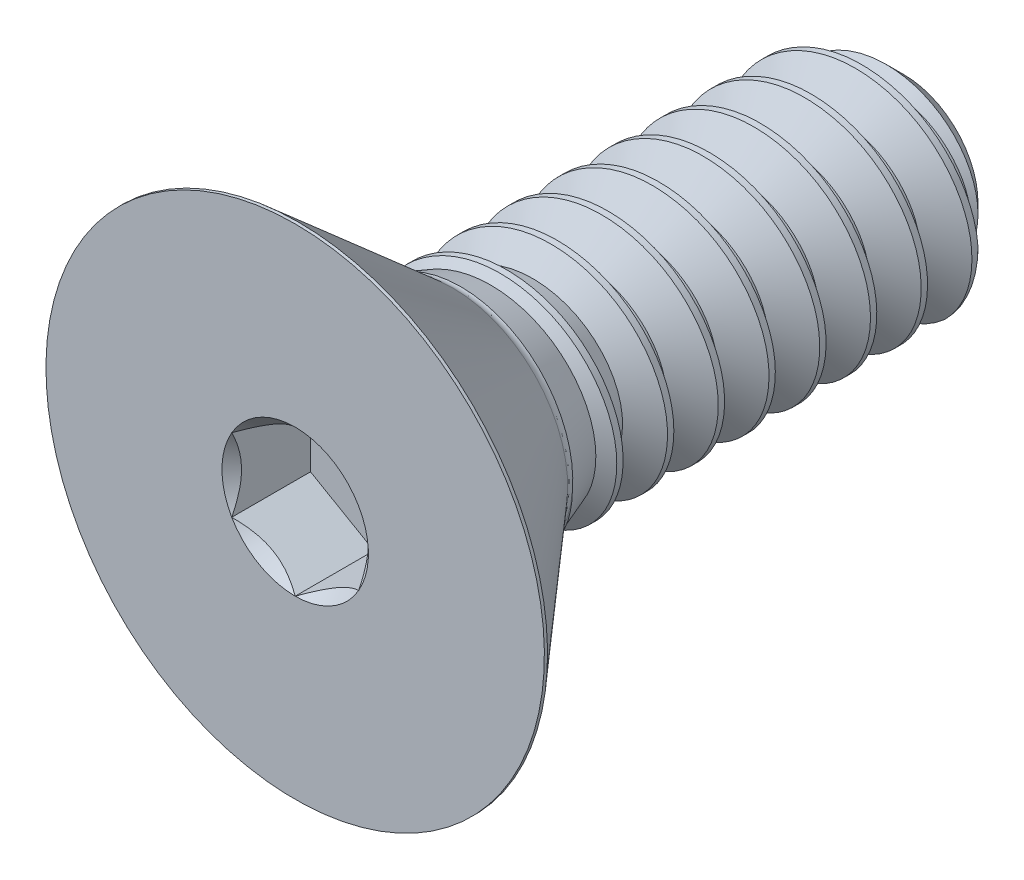
from build123d import *

# Parameters (mm, degrees)
CUT_EXTRUDE1_DEPTH = 1.2319
CUT_SWEEP1_PITCH   = 0.79375
CUT_SWEEP1_TO      = 6.93446


with BuildPart() as part:
    # Sketch11 → Revolve1 (revolve)
    with BuildSketch(Plane(origin=(0, 0, 0), x_dir=(0, 0, -1), z_dir=(1, 0, 0))):
        with BuildLine():
            Line((-4.713224, 3.8989), (-2.2987, 1.799986309))
            ThreePointArc((-2.2987, 1.799986309), (-2.2396142, 1.764833952), (-2.17195956, 1.7526))
            Line((-2.17195956, 1.7526), (4.1671875, 1.7526))
            Line((4.1671875, 1.7526), (4.7625, 1.1572875))
            Line((4.7625, 1.1572875), (4.7625, 0))
            Line((4.7625, 0), (-4.7625, 0))
            Line((-4.7625, 0), (-4.7625, 3.8989))
            Line((-4.7625, 3.8989), (-4.713224, 3.8989))
        make_face()
    revolve(axis=Axis((0, 0, -4.7625), (0, 0, 1)))

    # Cut-Extrude2 cone 1 section (through the dimple's axis) → Cut-Extrude2 (revolve, cut)
    with BuildSketch(Plane(origin=(0, 0, 4.7625), x_dir=(0, -1, 0), z_dir=(1, 0, 0))):
        Polygon((0, 0), (1.14567944, 0), (0, 1.14567944), align=None)
    revolve(axis=Axis((0, 0, 4.7625), (0, 0, -1)), mode=Mode.SUBTRACT)

    # Sketch9 → Cut-Extrude1 (cut)
    with BuildSketch(Plane.XY.offset(4.7625)):
        Polygon((0.9921875, -0.57283972), (0.9921875, 0.57283972), (0, 1.14567944), (-0.9921875, 0.57283972), (-0.9921875, -0.57283972), (0, -1.14567944), align=None)
    extrude(amount=-CUT_EXTRUDE1_DEPTH, mode=Mode.SUBTRACT)


with BuildPart() as body_2:
    # Split1: the piece on the far side of the plane
    add(part.part)
    split(bisect_by=Plane.XY.offset(2.17195956), keep=Keep.BOTTOM)

    # Cut-Sweep1: arcs per turn and ends read off the stored shape
    # Cut-Sweep1: the profile of Sketch4 screwed along a right-hand helix through 12 turns, 8 arcs to a turn; built about Z, then put on its axis
    cut_sweep1_z = Axis((0, 0, 0), (0, 0, 1))
    cut_sweep1_corners = [(1.795562979, 0, 0.024804687), (1.795562979, 0, -0.719335938), (1.237044252, 0, -0.396875), (1.237044252, 0, -0.29765625)]
    with BuildLine(mode=Mode.PRIVATE) as cut_sweep1_profile:
        Line(cut_sweep1_corners[0], cut_sweep1_corners[1])
        Line(cut_sweep1_corners[1], cut_sweep1_corners[2])
        Line(cut_sweep1_corners[2], cut_sweep1_corners[3])
        Line(cut_sweep1_corners[3], cut_sweep1_corners[0])
    cut_sweep1_cap = Face(cut_sweep1_profile.wire())
    cut_sweep1_turn_angles = [0, 22.5, 45, 67.5, 90, 112.5, 135, 157.5, 180, 202.5, 225, 247.5, 270, 292.5, 315, 337.5, 360]
    cut_sweep1_turn_weights = [1, 0.9238795325112867, 1, 0.9238795325112867, 1, 0.9238795325112867, 1, 0.9238795325112867, 1, 0.9238795325112867, 1, 0.9238795325112867, 1, 0.9238795325112867, 1, 0.9238795325112867, 1]
    cut_sweep1_turn_rails = [Edge.make_bspline([Vector(p[0], p[1], 0).rotate(cut_sweep1_z, cut_sweep1_turn_angles[k]) / cut_sweep1_turn_weights[k] + Vector(0, 0, p[2] + CUT_SWEEP1_PITCH * cut_sweep1_turn_angles[k] / 360) for k in range(17)], [0, 0, 0, 1, 1, 2, 2, 3, 3, 4, 4, 5, 5, 6, 6, 7, 7, 8, 8, 8], 2, cut_sweep1_turn_weights) for p in cut_sweep1_corners]
    cut_sweep1_turn_sides = [Face.make_surface_from_curves(cut_sweep1_turn_rails[p[0]], cut_sweep1_turn_rails[p[1]]) for p in [(0, 1), (1, 2), (2, 3), (3, 0)]]
    cut_sweep1 = Plane(origin=(0, 0, -4.7625), x_dir=(0, 1, 0), z_dir=(0, 0, 1)) * split(Solid(Shell([*[p.moved(Location((0, 0, CUT_SWEEP1_PITCH * i))) for i in range(12) for p in cut_sweep1_turn_sides], cut_sweep1_cap, cut_sweep1_cap.rotate(cut_sweep1_z, 4320).moved(Location((0, 0, CUT_SWEEP1_PITCH * 4320 / 360)))])), bisect_by=Plane.XY.offset(CUT_SWEEP1_TO), keep=Keep.BOTTOM, mode=Mode.PRIVATE)
    add(cut_sweep1, mode=Mode.SUBTRACT)


with BuildPart() as part_1:
    add(part.part)

    # Split1
    split(bisect_by=Plane.XY.offset(2.17195956), keep=Keep.TOP)

    add(body_2.part)  # Boss-Extrude2 merges body 2
    # Boss-Extrude2 cone 1 section (through the dimple's axis) → Boss-Extrude2 (revolve)
    with BuildSketch(Plane(origin=(0, 0, 2.17195956), x_dir=(0, -1, 0), z_dir=(1, 0, 0))):
        Polygon((0, 0), (1.7526, 0), (0, 4.815228925), align=None)
    revolve(axis=Axis((0, 0, 2.17195956), (0, 0, -1)))


solid = part_1.part
